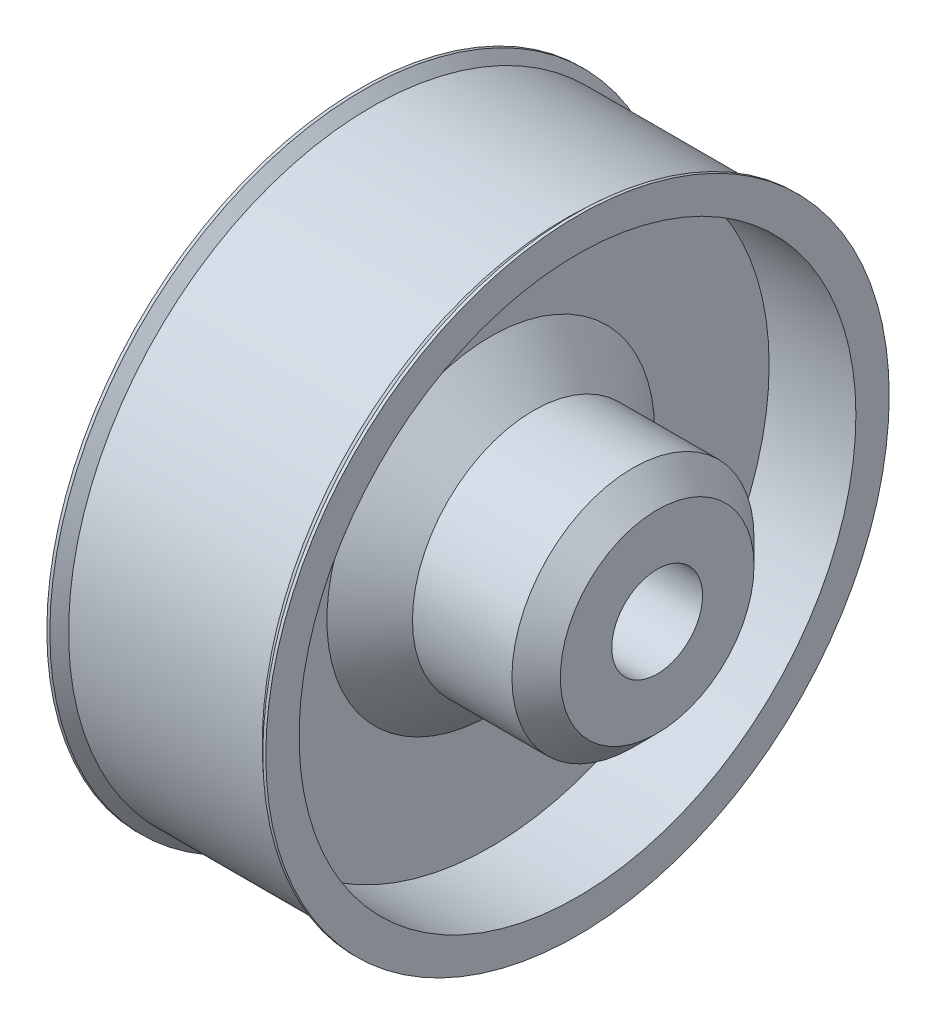
from build123d import *

# Parameters (mm, degrees)
BOSS_EXTRUDE1_DEPTH = 3
CIRPATTERN2_START   = -14.662710124
CIRPATTERN2_DEPTH   = 3
BOSS_EXTRUDE4_DEPTH = 15
BOSS_EXTRUDE5_DEPTH = 3
CIRPATTERN4_COUNT   = 6


# Read off the part's stored shape, not the designer's step: CirPattern2
with BuildPart() as part:
    # Sketch1 → Revolve1 (revolve)
    with BuildSketch(Plane.XY, mode=Mode.PRIVATE) as revolve1_sk:
        with BuildLine():
            Line((-18, 0), (0, 0))
            Line((0, 0), (0, 7.5))
            Line((0, 7.5), (27.5, 7.5))
            Line((27.5, 7.5), (27.5, 16))
            Line((27.5, 16), (23.5, 20))
            Line((23.5, 20), (7.071067812, 20))
            Line((7.071067812, 20), (0, 27.071067812))
            Line((0, 27.071067812), (0, 46))
            Line((0, 46), (14.337289876, 46))
            Line((14.337289876, 46), (14.337289876, 51.5))
            Line((14.337289876, 51.5), (13.837289876, 51.5))
            Line((13.837289876, 51.5), (12.337289876, 50.09004134))
            Line((12.337289876, 50.09004134), (-19.662710124, 50.09004134))
            Line((-19.662710124, 50.09004134), (-21.162710124, 51.685832808))
            Line((-21.162710124, 51.685832808), (-21.662710124, 51.685832808))
            Line((-21.662710124, 51.685832808), (-21.662710124, 47.807966179))
            ThreePointArc((-21.662710124, 47.807966179), (-21.076923686, 46.393752617), (-19.662710124, 45.807966179))
            Line((-19.662710124, 45.807966179), (-14.662710124, 45.807966179))
            ThreePointArc((-14.662710124, 45.807966179), (-12.54138978, 44.929286522), (-11.662710124, 42.807966179))
            Line((-11.662710124, 42.807966179), (-11.662710124, 33.089758348))
            ThreePointArc((-11.662710124, 33.089758348), (-12.265717914, 31.285754926), (-13.832329022, 30.206970249))
            ThreePointArc((-13.832329022, 30.206970249), (-19.256295256, 23.034859381), (-13.899233411, 15.812638644))
            ThreePointArc((-13.899233411, 15.812638644), (-12.351025091, 14.730537015), (-11.756376268, 12.937694101))
            Line((-11.756376268, 12.937694101), (-11.756376268, 6))
            Line((-11.756376268, 6), (-17.506303134, 3.75))
            Line((-17.506303134, 3.75), (-18, 0))
        make_face()
    revolve(revolve1_sk.sketch.rotate(Axis((0, 0, 0), (-1, 0, 0)), 90), axis=Axis((0, 0, 0), (-1, 0, 0)))

    # Sketch3 → Boss-Extrude1 (add)
    with BuildSketch(Plane.ZY.offset(11.662710124)):
        Polygon((-10.78173197, 32.951329215), (-9.338356297, 35.451329215), (-10.78173197, 37.951329215), (-13.668483316, 37.951329215), (-15.111858989, 35.451329215), (-13.668483316, 32.951329215), align=None)
    extrude(amount=BOSS_EXTRUDE1_DEPTH)

    # CirPattern2 outline → CirPattern2 (add)
    with BuildSketch(Plane.YZ.offset(CIRPATTERN2_START)):
        Polygon((15.676272548, -30.923944126), (13.635031096, -32.965185578), (14.382177323, -35.753573258), (17.170565002, -36.500719484), (19.211806454, -34.459478032), (18.464660227, -31.671090353), align=None)
        Polygon((-10.78173197, -32.951329215), (-13.668483316, -32.951329215), (-15.111858989, -35.451329215), (-13.668483316, -37.951329215), (-10.78173197, -37.951329215), (-9.338356297, -35.451329215), align=None)
        Polygon((-30.923944126, -15.676272548), (-32.965185578, -13.635031096), (-35.753573258, -14.382177323), (-36.500719484, -17.170565002), (-34.459478032, -19.211806454), (-31.671090353, -18.464660227), align=None)
        Polygon((-32.951329215, 10.78173197), (-32.951329215, 13.668483316), (-35.451329215, 15.111858989), (-37.951329215, 13.668483316), (-37.951329215, 10.78173197), (-35.451329215, 9.338356297), align=None)
        Polygon((-15.676272548, 30.923944126), (-13.635031096, 32.965185578), (-14.382177323, 35.753573258), (-17.170565002, 36.500719484), (-19.211806454, 34.459478032), (-18.464660227, 31.671090353), align=None)
        Polygon((10.78173197, 32.951329215), (13.668483316, 32.951329215), (15.111858989, 35.451329215), (13.668483316, 37.951329215), (10.78173197, 37.951329215), (9.338356297, 35.451329215), align=None)
        Polygon((30.923944126, 15.676272548), (32.965185578, 13.635031096), (35.753573258, 14.382177323), (36.500719484, 17.170565002), (34.459478032, 19.211806454), (31.671090353, 18.464660227), align=None)
    extrude(amount=CIRPATTERN2_DEPTH)

    # Sketch2 → Boss-Extrude4 (add)
    with BuildSketch(Plane(origin=(0, 0, 0), x_dir=(0, 0, -1), z_dir=(1, 0, 0))):
        Polygon((7.765457102, 0.52381741), (10.038194204, -0.517655617), (12.076504853, 0.929855936), (11.842078401, 3.418840516), (9.569341299, 4.460313543), (7.531030649, 3.01280199), align=None)
    extrude(amount=BOSS_EXTRUDE4_DEPTH)

    # Sketch5 → Boss-Extrude5 (add)
    with BuildSketch(Plane.ZY.offset(11.756376268)):
        Polygon((12.21037892, 1.171511407), (10.090630821, 2.5), (7.880251901, 1.328488593), (7.78962108, -1.171511407), (9.909369179, -2.5), (12.119748099, -1.328488593), align=None)
    boss_extrude5 = extrude(amount=BOSS_EXTRUDE5_DEPTH)

    # CirPattern4: Boss-Extrude5 ×6 about axis
    cirpattern4_axis = Axis((0, 0, 0), (1, 0, 0))
    for i in range(1, CIRPATTERN4_COUNT):
        add(boss_extrude5.rotate(cirpattern4_axis, i * 360 / CIRPATTERN4_COUNT))


solid = part.part
